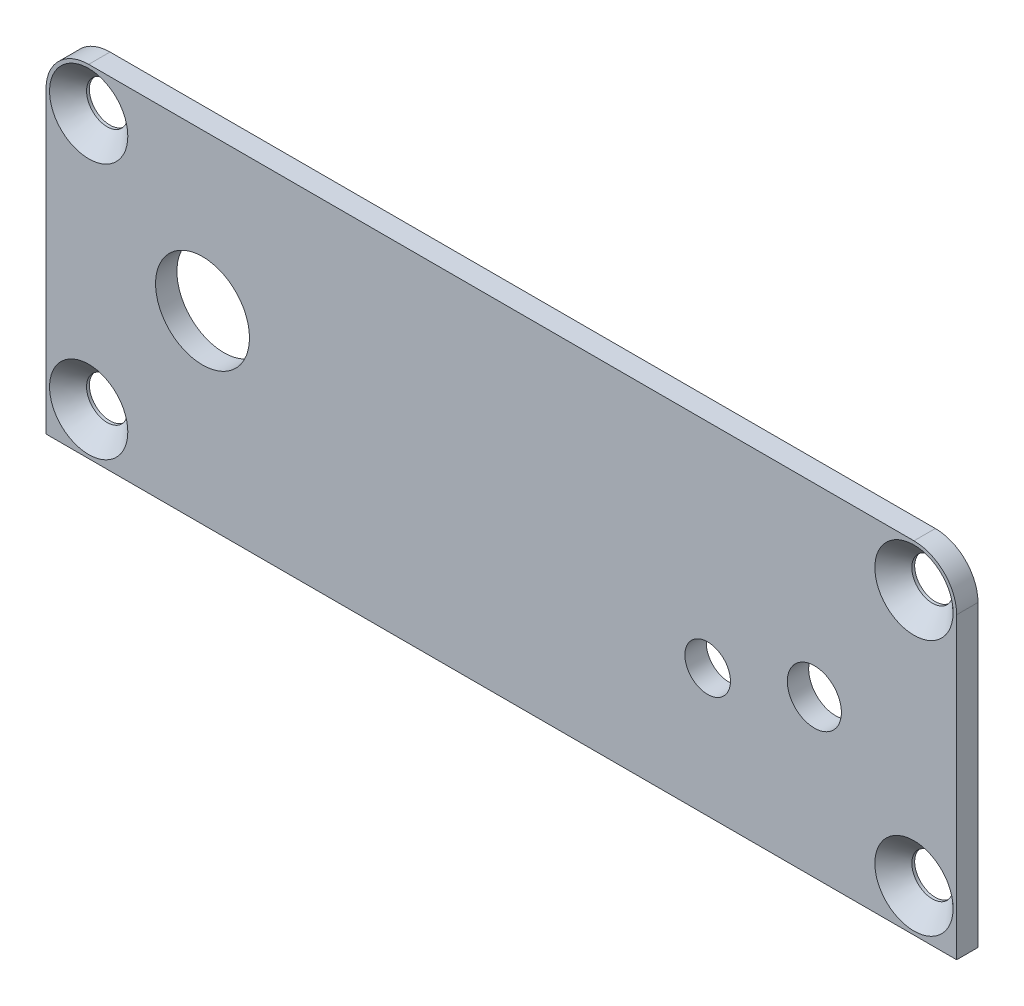
from build123d import *

# Parameters (mm, degrees)
SKETCH1_W                                      = 64
SKETCH1_H                                      = 24
BOSS_EXTRUDE1_DEPTH                            = 1.5
CSK_FOR_M2_5_FLAT_HEAD_MACHINE_SCREW1_AT_COUNT = 2
CSK_FOR_M2_5_FLAT_HEAD_MACHINE_SCREW1_AT_PITCH = 58
CSK_FOR_M2_5_FLAT_HEAD_MACHINE_SCREW_2_COUNT   = 2
CSK_FOR_M2_5_FLAT_HEAD_MACHINE_SCREW_2_PITCH   = 18
CSK_FOR_M2_5_FLAT_HEAD_MACHINE_SCREW_3_COUNT   = 2
CSK_FOR_M2_5_FLAT_HEAD_MACHINE_SCREW_3_PITCH   = 60.728905803
FILLET1_R                                      = 3
SKETCH4_R                                      = 3.3
CUT_EXTRUDE1_DEPTH                             = 35.208916966
SKETCH5_R                                      = 1.6
CUT_EXTRUDE2_DEPTH                             = 35.208916966
SKETCH6_R                                      = 1.9
CUT_EXTRUDE3_DEPTH                             = 35.208916966


with BuildPart() as part:
    # Sketch1 → Boss-Extrude1 (new body)
    with BuildSketch(Plane.XY):
        Rectangle(SKETCH1_W, SKETCH1_H)
    extrude(amount=-BOSS_EXTRUDE1_DEPTH)

    # Sketch2 → CSK for M2.5 Flat Head Machine Screw1 (revolve, cut)
    with BuildSketch(Plane(origin=(-29, 9, 0), x_dir=(0, -1, 0), z_dir=(1, 0, 0))):
        Polygon((0, 0), (0, 1.5), (1.45, 1.5), (1.45, 1.3), (2.75, 0), align=None)
    csk_for_m2_5_flat_head_machine_screw1 = revolve(axis=Axis((-29, 9, 6.35), (0, 0, -1)), mode=Mode.SUBTRACT)

    # CSK for M2.5 Flat Head Machine Screw1 at: CSK for M2.5 Flat Head Machine Screw1 ×2
    with Locations(*[(i * CSK_FOR_M2_5_FLAT_HEAD_MACHINE_SCREW1_AT_PITCH, 0, 0) for i in range(1, CSK_FOR_M2_5_FLAT_HEAD_MACHINE_SCREW1_AT_COUNT)]):
        add(csk_for_m2_5_flat_head_machine_screw1, mode=Mode.SUBTRACT)

    # CSK for M2.5 Flat Head Machine Screw 2: CSK for M2.5 Flat Head Machine Screw1 ×2
    with Locations(*[(0, -i * CSK_FOR_M2_5_FLAT_HEAD_MACHINE_SCREW_2_PITCH, 0) for i in range(1, CSK_FOR_M2_5_FLAT_HEAD_MACHINE_SCREW_2_COUNT)]):
        add(csk_for_m2_5_flat_head_machine_screw1, mode=Mode.SUBTRACT)

    # CSK for M2.5 Flat Head Machine Screw 3: CSK for M2.5 Flat Head Machine Screw1 ×2
    with Locations(*[Vector(0.9550641368112371, -0.2963992148724529, 0) * (i * CSK_FOR_M2_5_FLAT_HEAD_MACHINE_SCREW_3_PITCH) for i in range(1, CSK_FOR_M2_5_FLAT_HEAD_MACHINE_SCREW_3_COUNT)]):
        add(csk_for_m2_5_flat_head_machine_screw1, mode=Mode.SUBTRACT)

    # Fillet1
    fillet1_edges = [part.edges().sort_by_distance(p)[0] for p in [
        (-32, 12, -0.75),
        (32, 12, -0.75),
    ]]
    fillet(fillet1_edges, radius=FILLET1_R)

    # Sketch4 → Cut-Extrude1 (cut, through all)
    with BuildSketch(Plane.XY):
        with Locations((-21, 1)):
            Circle(SKETCH4_R)
    extrude(amount=-CUT_EXTRUDE1_DEPTH, mode=Mode.SUBTRACT)

    # Sketch5 → Cut-Extrude2 (cut, through all)
    with BuildSketch(Plane.XY):
        with Locations((14.5, -3)):
            Circle(SKETCH5_R)
    extrude(amount=-CUT_EXTRUDE2_DEPTH, mode=Mode.SUBTRACT)

    # Sketch6 → Cut-Extrude3 (cut, through all)
    with BuildSketch(Plane.XY):
        with Locations((22, -1)):
            Circle(SKETCH6_R)
    extrude(amount=-CUT_EXTRUDE3_DEPTH, mode=Mode.SUBTRACT)


solid = part.part
